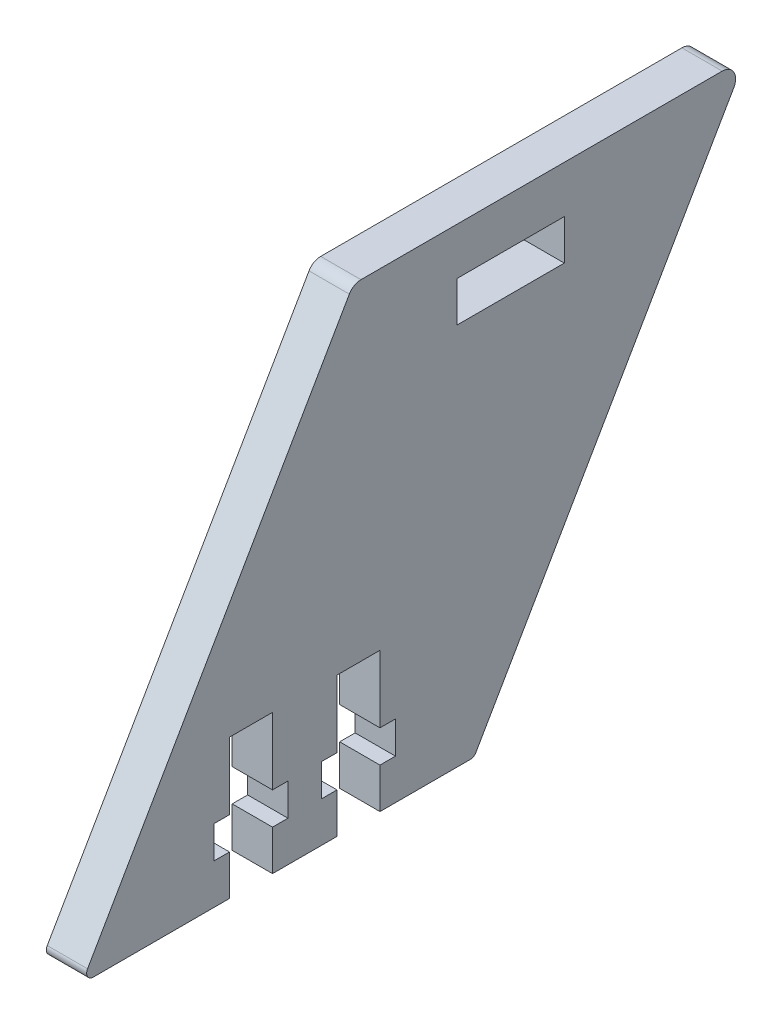
from build123d import *

# Parameters (mm, degrees)
SKETCH1_W           = 8
SKETCH1_H           = 3
BOSS_EXTRUDE1_DEPTH = 3
FILLET1_R           = 1
FILLET2_R           = 0.5


with BuildPart() as part:
    # Sketch1 → Boss-Extrude1 (new body)
    with BuildSketch(Plane(origin=(0, 0, 0), x_dir=(0, 0, -1), z_dir=(1, 0, 0))):
        Polygon((-5.6, 0), (-5.6, 3), (-6.75, 3), (-6.75, 5.4), (-5.6, 5.4), (-5.6, 10.4), (-2.4, 10.4), (-2.4, 5.4), (-1.25, 5.4), (-1.25, 3), (-2.4, 3), (-2.4, 0), (2.4, 0), (2.4, 3), (1.25, 3), (1.25, 5.4), (2.4, 5.4), (2.4, 10.4), (5.6, 10.4), (5.6, 5.4), (6.75, 5.4), (6.75, 3), (5.6, 3), (5.6, 0), (12.6, 0), (32.807259422, 35), (3.607259422, 35), (-16.6, 0), align=None)
        with Locations((15.320508076, 30)):
            Rectangle(SKETCH1_W, SKETCH1_H, mode=Mode.SUBTRACT)
    extrude(amount=BOSS_EXTRUDE1_DEPTH)

    # Fillet1
    fillet1_edges = [part.edges().sort_by_distance(p)[0] for p in [
        (1.5, 35, -32.807259422),
        (1.5, 35, -3.607259422),
    ]]
    fillet(fillet1_edges, radius=FILLET1_R)

    # Fillet2
    fillet2_edges = [part.edges().sort_by_distance(p)[0] for p in [
        (1.5, 0, 16.6),
        (1.5, 0, -12.6),
    ]]
    fillet(fillet2_edges, radius=FILLET2_R)


solid = part.part
